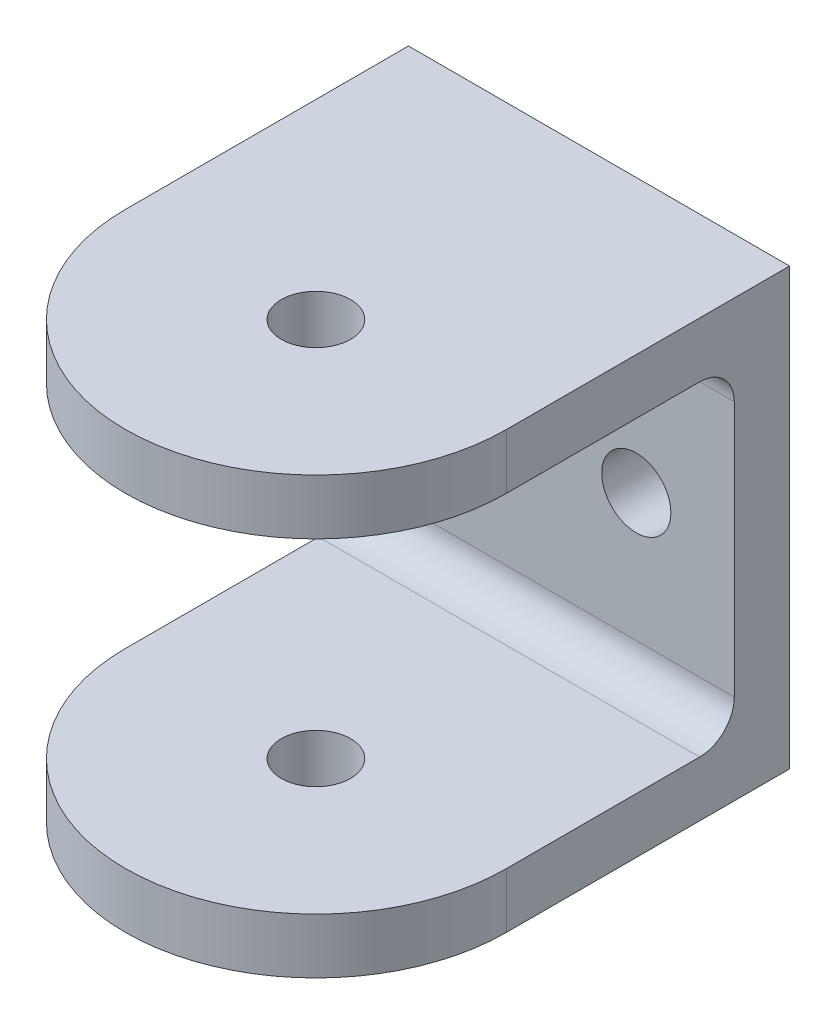
from build123d import *

# Parameters (mm, degrees)
SKETCH1_W           = 35
SKETCH1_H           = 40
SKETCH1_R           = 3.175
BOSS_EXTRUDE1_DEPTH = 5.08
SKETCH2_W           = 35
SKETCH2_H           = 5.08
BOSS_EXTRUDE2_DEPTH = 39
FILLET1_R           = 3.175
SKETCH3_R           = 3.175
CUT_EXTRUDE1_DEPTH  = 63.042698201


with BuildPart() as part:
    # Sketch1 → Boss-Extrude1 (new body)
    with BuildSketch(Plane.XY):
        Rectangle(SKETCH1_W, SKETCH1_H)
        with Locations((8.5, 0)):
            Circle(SKETCH1_R, mode=Mode.SUBTRACT)
        with Locations((-8.5, 0)):
            Circle(SKETCH1_R, mode=Mode.SUBTRACT)
    extrude(amount=BOSS_EXTRUDE1_DEPTH)

    # Sketch2 → Boss-Extrude2 (add)
    with BuildSketch(Plane.XY.offset(5.08)):
        with Locations((0, 17.46)):
            Rectangle(SKETCH2_W, SKETCH2_H)
        with Locations((0, -17.46)):
            Rectangle(SKETCH2_W, SKETCH2_H)
    extrude(amount=BOSS_EXTRUDE2_DEPTH)

    # Fillet1
    fillet1_edges = [part.edges().sort_by_distance(p)[0] for p in [
        (0, 14.92, 5.08),
        (0, -14.92, 5.08),
    ]]
    fillet(fillet1_edges, radius=FILLET1_R)

    # Sketch3 → Cut-Extrude1 (cut, through all)
    with BuildSketch(Plane(origin=(0, 20, 0), x_dir=(1, 0, 0), z_dir=(0, 1, 0))):
        with Locations((0, -26)):
            Circle(SKETCH3_R)
        with BuildLine():
            Line((17.5, -44.08), (17.5, -26))
            ThreePointArc((17.5, -26), (0, -43.5), (-17.5, -26))
            Line((-17.5, -26), (-17.5, -44.08))
            Line((-17.5, -44.08), (17.5, -44.08))
        make_face()
    extrude(amount=-CUT_EXTRUDE1_DEPTH, mode=Mode.SUBTRACT)


solid = part.part
